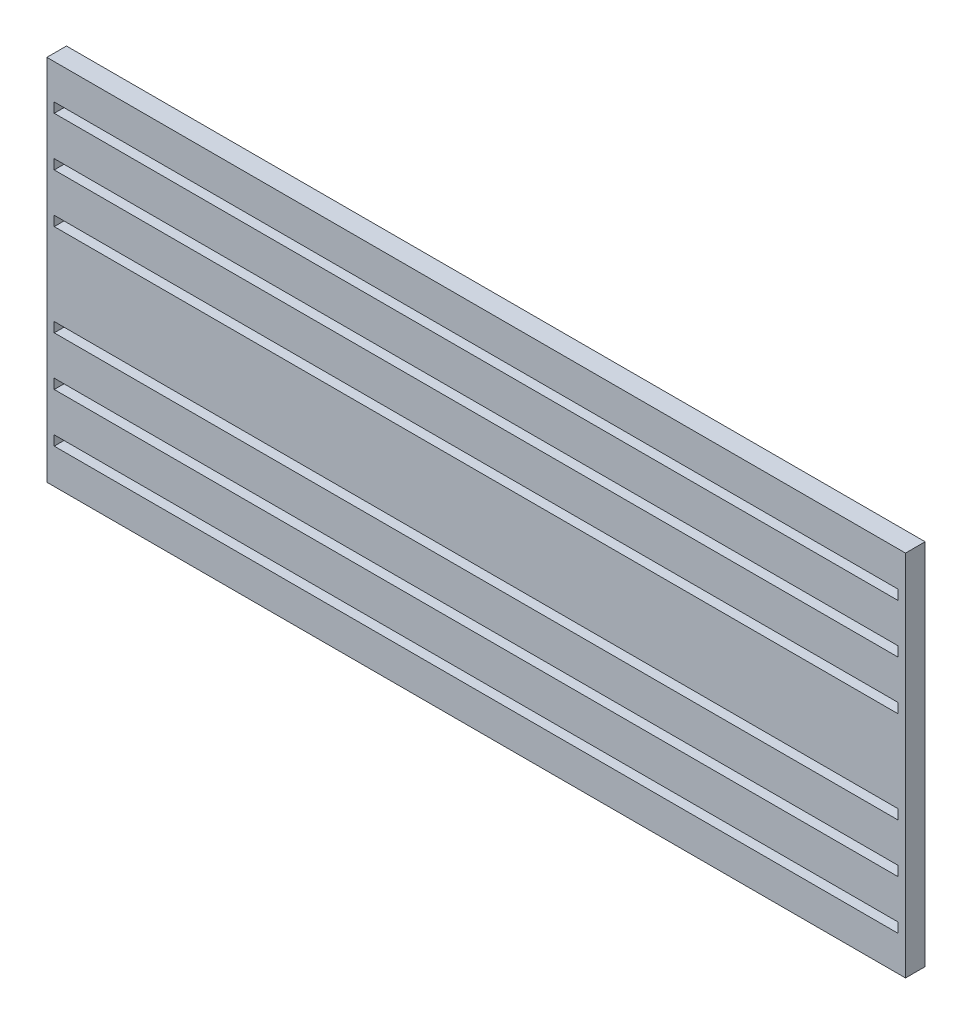
from build123d import *

# Parameters (mm, degrees)
SKETCH1_W           = 222.25
SKETCH1_H           = 95.25
BOSS_EXTRUDE1_DEPTH = 5.08
SKETCH2_W           = 218.44
SKETCH2_H           = 2.54
CUT_EXTRUDE1_DEPTH  = 5.08


with BuildPart() as part:
    # Sketch1 → Boss-Extrude1 (new body)
    with BuildSketch(Plane.XY):
        Rectangle(SKETCH1_W, SKETCH1_H)
    extrude(amount=BOSS_EXTRUDE1_DEPTH)

    # Sketch2 → Cut-Extrude1 (cut)
    with BuildSketch(Plane(origin=(0, 0, 0), x_dir=(-1, 0, 0), z_dir=(0, 0, -1))):
        with Locations((0, 24.60625)):
            Rectangle(SKETCH2_W, SKETCH2_H)
        with Locations((0, 11.90625)):
            Rectangle(SKETCH2_W, SKETCH2_H)
        with Locations((0, 37.30625)):
            Rectangle(SKETCH2_W, SKETCH2_H)
        with Locations((0, -11.90625)):
            Rectangle(SKETCH2_W, SKETCH2_H)
        with Locations((0, -24.60625)):
            Rectangle(SKETCH2_W, SKETCH2_H)
        with Locations((0, -37.30625)):
            Rectangle(SKETCH2_W, SKETCH2_H)
    extrude(amount=-CUT_EXTRUDE1_DEPTH, mode=Mode.SUBTRACT)


solid = part.part
